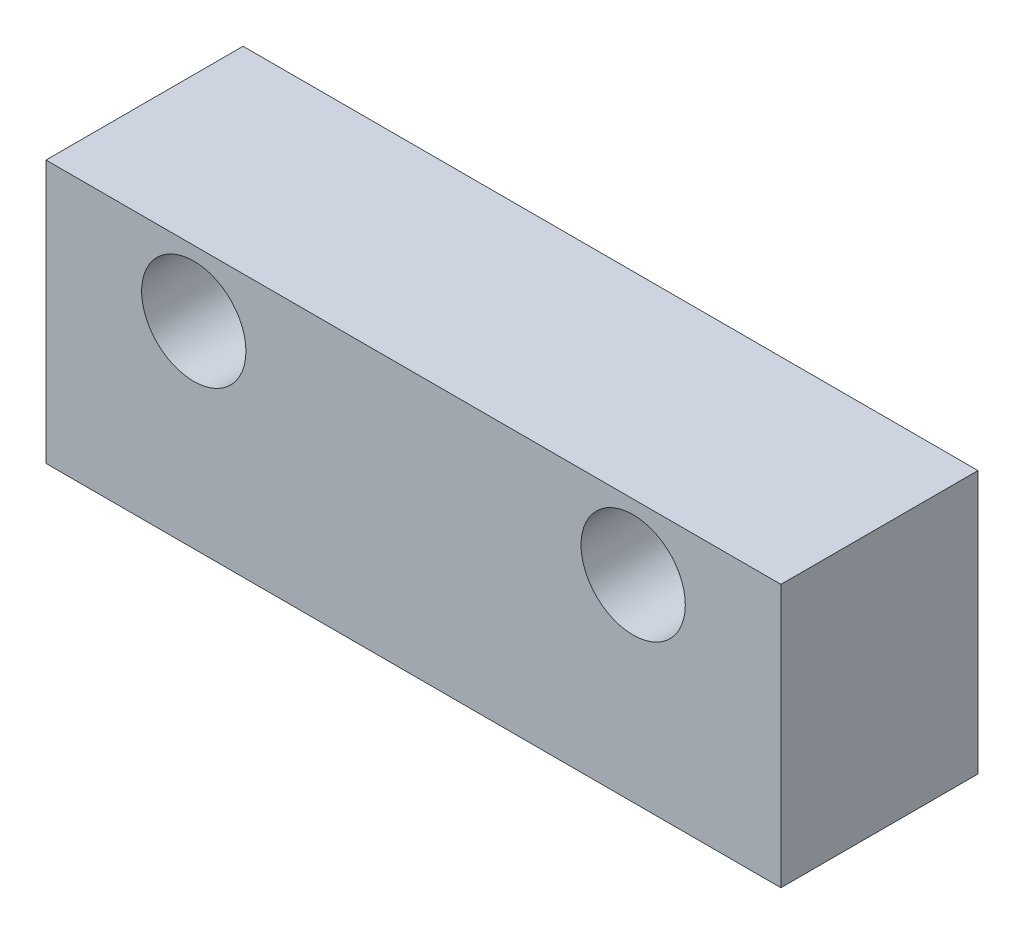
from build123d import *

# Parameters (mm, degrees)
SKETCH1_W           = 44.75
SKETCH1_H           = 16
SKETCH1_R           = 3.175
BOSS_EXTRUDE1_DEPTH = 12


with BuildPart() as part:
    # Sketch1 → Boss-Extrude1 (new body)
    with BuildSketch(Plane.XY):
        with Locations((0, -4)):
            Rectangle(SKETCH1_W, SKETCH1_H)
        with Locations((13.377, 0)):
            Circle(SKETCH1_R, mode=Mode.SUBTRACT)
        with Locations((-13.377, 0)):
            Circle(SKETCH1_R, mode=Mode.SUBTRACT)
    extrude(amount=BOSS_EXTRUDE1_DEPTH)


solid = part.part
